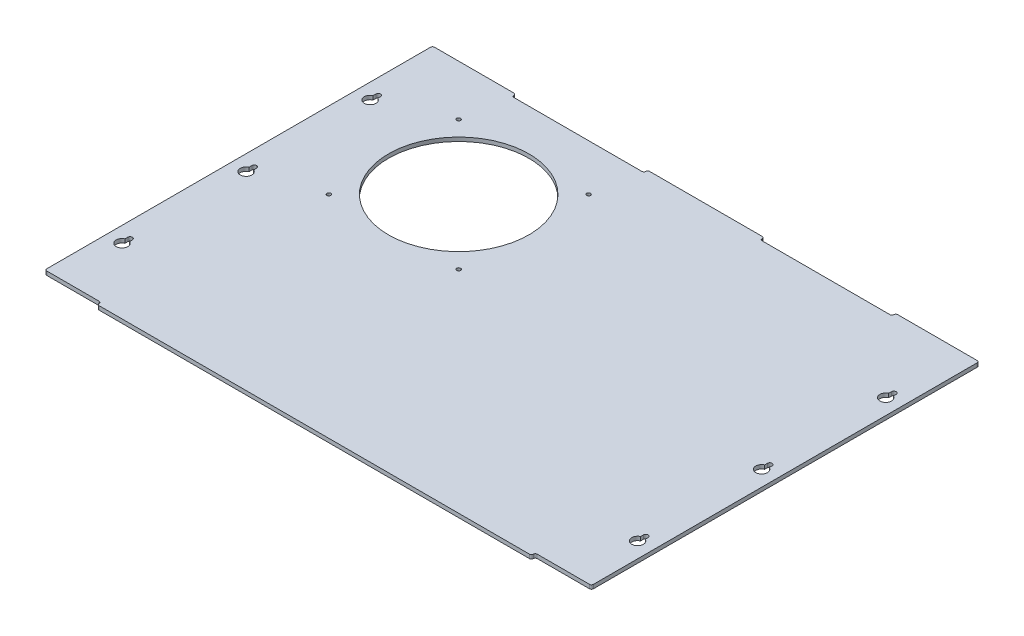
from build123d import *

# Parameters (mm, degrees)
BOSS_EXTRUDE1_DEPTH  = 3.175
SKETCH3_W            = 107.95
SKETCH3_H            = 3.175
CUT_EXTRUDE2_DEPTH   = 549.843544419
FILLET1_R            = 1.5875
CUT_EXTRUDE1_DEPTH   = 549.843544419
LPATTERN1_COUNT      = 3
LPATTERN1_PITCH      = 101.6
MIRROR1_COPY_1_DEPTH = 549.843544419
MIRROR1_COPY_2_DEPTH = 549.843544419
SKETCH4_R            = 1.5875
SKETCH4_R_2          = 57.5
CUT_EXTRUDE3_DEPTH   = 549.843544419


with BuildPart() as part:
    # Sketch1 → Boss-Extrude1 (new body)
    with BuildSketch(Plane(origin=(0, 0, 0), x_dir=(1, 0, 0), z_dir=(0, 1, 0))):
        Polygon((401.6375, 0), (447.675, 0), (447.675, 317.5), (0, 317.5), (0, 0), (46.0375, 0), (46.0375, -3.175), (401.6375, -3.175), align=None)
    extrude(amount=BOSS_EXTRUDE1_DEPTH)

    # Sketch3 → Cut-Extrude2 (cut, through all)
    with BuildSketch(Plane(origin=(0, 3.175, 0), x_dir=(1, 0, 0), z_dir=(0, 1, 0))):
        with Locations((122.2375, 315.9125)):
            Rectangle(SKETCH3_W, SKETCH3_H)
        with Locations((325.4375, 315.9125)):
            Rectangle(SKETCH3_W, SKETCH3_H)
    extrude(amount=-CUT_EXTRUDE2_DEPTH, mode=Mode.SUBTRACT)

    # Fillet1
    fillet1_edges = [part.edges().sort_by_distance(p)[0] for p in [
        (379.4125, 1.5875, -317.5),
        (271.4625, 1.5875, -317.5),
        (176.2125, 1.5875, -317.5),
        (68.2625, 1.5875, -317.5),
        (379.4125, 1.5875, -314.325),
        (271.4625, 1.5875, -314.325),
        (176.2125, 1.5875, -314.325),
        (68.2625, 1.5875, -314.325),
        (447.675, 1.5875, -317.5),
        (447.675, 1.5875, 0),
        (0, 1.5875, 0),
        (0, 1.5875, -317.5),
        (401.6375, 1.5875, 3.175),
        (401.6375, 1.5875, 0),
        (46.0375, 1.5875, 3.175),
        (46.0375, 1.5875, 0),
    ]]
    fillet(fillet1_edges, radius=FILLET1_R - 0.0001)  # a hair under: the kernel refuses the full size

    # Sketch2 → Cut-Extrude1 (cut, through all)
    with BuildSketch(Plane(origin=(0, 3.175, 0), x_dir=(1, 0, 0), z_dir=(0, 1, 0))):
        with BuildLine():
            Line((10.795, 258.047403349), (10.795, 260.35))
            ThreePointArc((10.795, 260.35), (12.7, 262.255), (14.605, 260.35))
            Line((14.605, 260.35), (14.605, 258.047403349))
            ThreePointArc((14.605, 258.047403349), (12.7, 248.92), (10.795, 258.047403349))
        make_face()
    cut_extrude1 = extrude(amount=-CUT_EXTRUDE1_DEPTH, mode=Mode.SUBTRACT)

    # LPattern1: Cut-Extrude1 ×3
    with Locations(*[(0, 0, i * LPATTERN1_PITCH) for i in range(1, LPATTERN1_COUNT)]):
        add(cut_extrude1, mode=Mode.SUBTRACT)

    # Mirror1: Cut-Extrude1 across plane
    add(cut_extrude1.mirror(Plane.ZY.offset(-223.8375)), mode=Mode.SUBTRACT)

    # Mirror1 copy 1 sketch → Mirror1 copy 1 (cut, through all)
    with BuildSketch(Plane(origin=(447.675, 3.175, 101.6), x_dir=(-1, 0, 0), z_dir=(0, 1, 0))):
        with BuildLine():
            Line((10.795, -258.047403349), (10.795, -260.35))
            ThreePointArc((10.795, -260.35), (12.7, -262.255), (14.605, -260.35))
            Line((14.605, -260.35), (14.605, -258.047403349))
            ThreePointArc((14.605, -258.047403349), (12.7, -248.92), (10.795, -258.047403349))
        make_face()
    extrude(amount=-MIRROR1_COPY_1_DEPTH, mode=Mode.SUBTRACT)

    # Mirror1 copy 2 sketch → Mirror1 copy 2 (cut, through all)
    with BuildSketch(Plane(origin=(447.675, 3.175, 203.2), x_dir=(-1, 0, 0), z_dir=(0, 1, 0))):
        with BuildLine():
            Line((10.795, -258.047403349), (10.795, -260.35))
            ThreePointArc((10.795, -260.35), (12.7, -262.255), (14.605, -260.35))
            Line((14.605, -260.35), (14.605, -258.047403349))
            ThreePointArc((14.605, -258.047403349), (12.7, -248.92), (10.795, -258.047403349))
        make_face()
    extrude(amount=-MIRROR1_COPY_2_DEPTH, mode=Mode.SUBTRACT)

    # Sketch4 → Cut-Extrude3 (cut, through all)
    with BuildSketch(Plane(origin=(0, 3.175, 0), x_dir=(1, 0, 0), z_dir=(0, 1, 0))):
        with Locations(Location((62.70625, 276.225, 0), (0, 0, 270))):
            Circle(SKETCH4_R)
        with Locations(Location((169.06875, 276.225, 0), (0, 0, 270))):
            Circle(SKETCH4_R)
        with Locations(Location((169.06875, 169.8625, 0), (0, 0, 270))):
            Circle(SKETCH4_R)
        with Locations(Location((62.70625, 169.8625, 0), (0, 0, 270))):
            Circle(SKETCH4_R)
        with Locations(Location((115.8875, 223.04375, 0), (0, 0, 270))):
            Circle(SKETCH4_R_2)
    extrude(amount=-CUT_EXTRUDE3_DEPTH, mode=Mode.SUBTRACT)


solid = part.part
